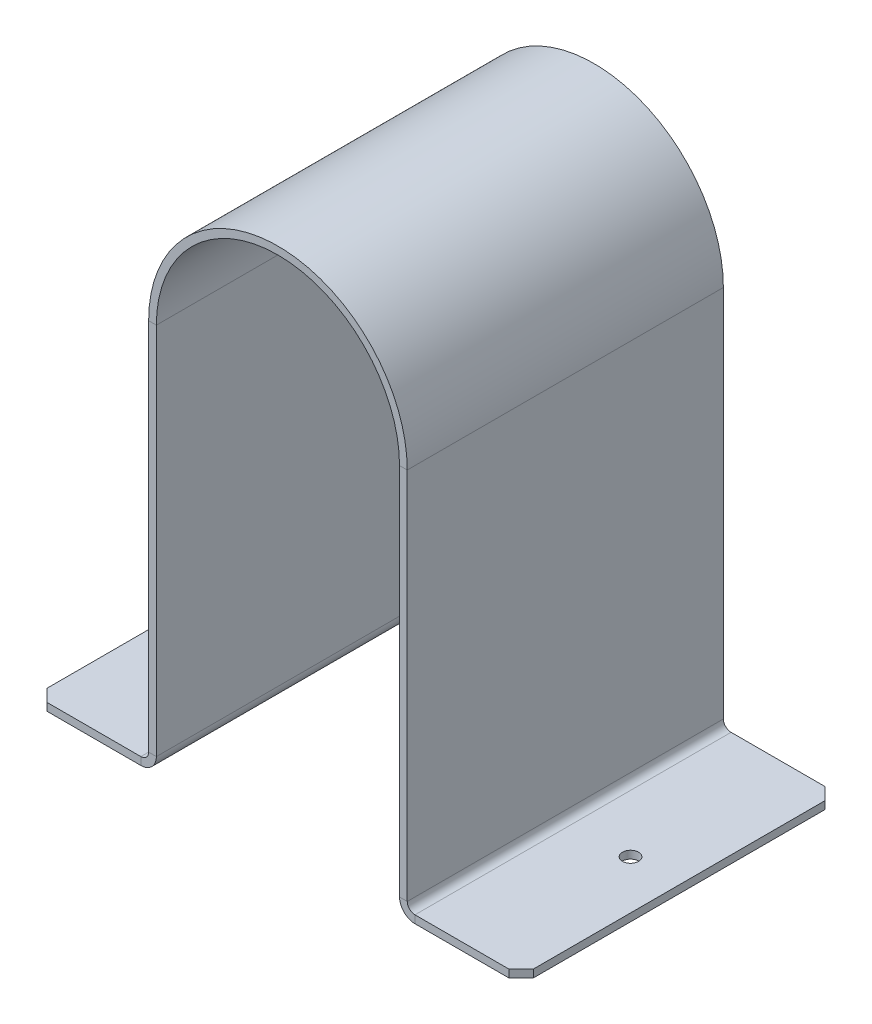
from build123d import *

# Parameters (mm, degrees)
BASE_FLANGE1_DEPTH         = 65
F_6_6_6_6_DIAMETER_HOLE1_D = 6.6
BREAK_CORNER1_DEPTH        = 3.175


# Read off the part's stored shape, not the designer's step: Break-Corner1
# Sheet-metal steps are written as plain solids
with BuildPart() as part:
    # Sketch1 → Base-Flange1 (new, symmetric)
    with BuildSketch(Plane.XY):
        with BuildLine():
            Line((-100, 0), (-56.35, 0))
            ThreePointArc((-56.35, 0), (-51.859871939, 1.859871939), (-50, 6.35))
            Line((-50, 6.35), (-50, 160))
            ThreePointArc((-50, 160), (0, 210), (50, 160))
            Line((50, 160), (50, 6.35))
            ThreePointArc((50, 6.35), (51.859871939, 1.859871939), (56.35, 0))
            Line((56.35, 0), (100, 0))
            Line((100, 0), (100, 3.175))
            Line((100, 3.175), (56.35, 3.175))
            ThreePointArc((56.35, 3.175), (54.10493597, 4.10493597), (53.175, 6.35))
            Line((53.175, 6.35), (53.175, 160))
            ThreePointArc((53.175, 160), (0, 213.175), (-53.175, 160))
            Line((-53.175, 160), (-53.175, 6.35))
            ThreePointArc((-53.175, 6.35), (-54.10493597, 4.10493597), (-56.35, 3.175))
            Line((-56.35, 3.175), (-100, 3.175))
            Line((-100, 3.175), (-100, 0))
        make_face()
    extrude(amount=BASE_FLANGE1_DEPTH, both=True)

    # Ø6.6 (6.6) Diameter Hole1 (through all)
    with Locations(Plane(origin=(0, 3.175, 0), x_dir=(1, 0, 0), z_dir=(0, 1, 0))):
        with Locations((-80, 0), (80, 0)):
            Hole(F_6_6_6_6_DIAMETER_HOLE1_D / 2)

    # Break-Corner1 outline → Break-Corner1 (cut)
    with BuildSketch(Plane(origin=(0, 0, 0), x_dir=(1, 0, 0), z_dir=(0, 1, 0))):
        Polygon((-100, -65), (-95, -65), (-100, -60), align=None)
        Polygon((-100, 65), (-100, 60), (-95, 65), align=None)
        Polygon((100, -65), (100, -60), (95, -65), align=None)
        Polygon((95, 65), (100, 60), (100, 65), align=None)
    extrude(amount=BREAK_CORNER1_DEPTH, mode=Mode.SUBTRACT)


solid = part.part
